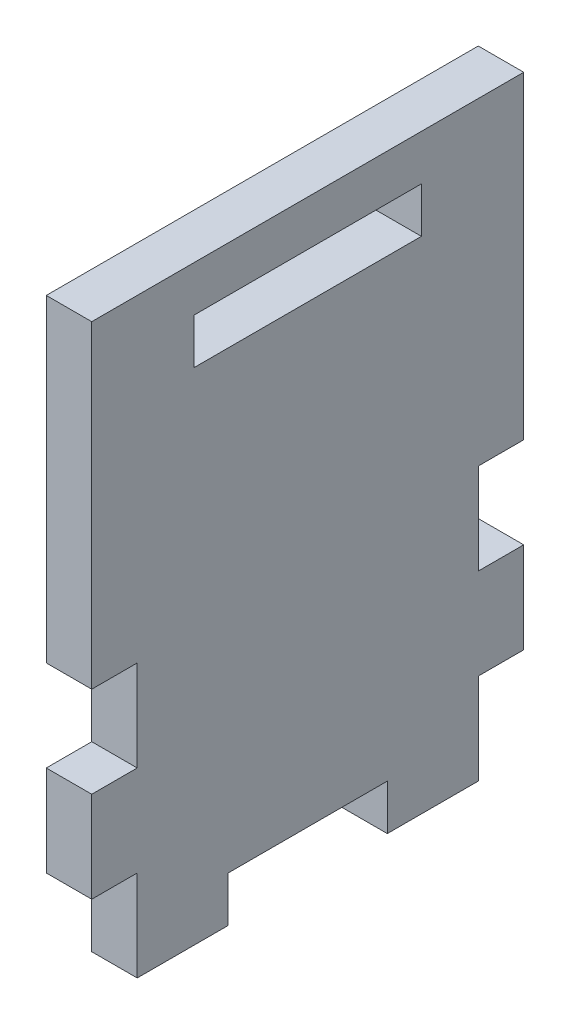
from build123d import *

# Parameters (mm, degrees)
PAREDEESBOCO_W = 15
PAREDEESBOCO_H = 3
PAREDE_DEPTH   = 3


with BuildPart() as part:
    # ParedeEsboco → Parede (new body)
    with BuildSketch(Plane(origin=(0, 0, 0), x_dir=(0, 0, -1), z_dir=(1, 0, 0))):
        Polygon((14.25, -13.5), (11.25, -13.5), (11.25, -19.5), (5.25, -19.5), (5.25, -16.5), (-5.25, -16.5), (-5.25, -19.5), (-11.25, -19.5), (-11.25, -13.5), (-14.25, -13.5), (-14.25, -7.5), (-11.25, -7.5), (-11.25, -1.5), (-14.25, -1.5), (-14.25, 10.5), (-14.25, 19.5), (14.25, 19.5), (14.25, 10.5), (14.25, -1.5), (11.25, -1.5), (11.25, -7.5), (14.25, -7.5), align=None)
        with Locations((0, 15)):
            Rectangle(PAREDEESBOCO_W, PAREDEESBOCO_H, mode=Mode.SUBTRACT)
    extrude(amount=PAREDE_DEPTH)


solid = part.part
